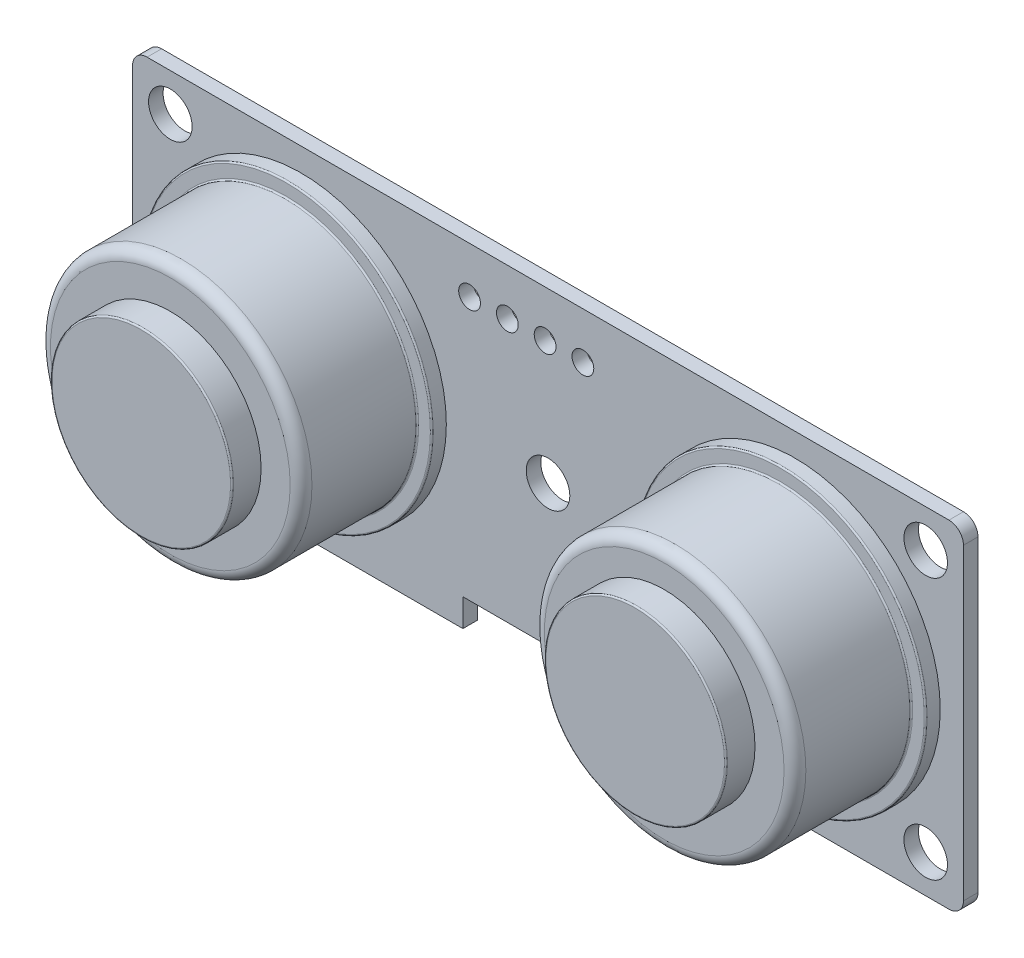
from build123d import *

# Parameters (mm, degrees)
IZIM1_R                       = 1.5
IZIM1_R_2                     = 0.9
IZIM1_R_3                     = 0.75
Y_KSEKLIK_EKSTR_ZYON1_DEPTH   = 1
IZIM2_R                       = 10
Y_KSEKLIK_EKSTR_ZYON2_DEPTH   = 1
Y_KSEKLIK_EKSTR_ZYON2_2_DEPTH = 1
IZIM3_R                       = 9
Y_KSEKLIK_EKSTR_ZYON3_DEPTH   = 8
IZIM4_R                       = 6.25
Y_KSEKLIK_EKSTR_ZYON4_DEPTH   = 2
Y_KSEKLIK_EKSTR_ZYON4_2_DEPTH = 2
RADYUS1_R                     = 0.75
RADYUS2_R                     = 0.75
RADYUS3_R                     = 0.1
RADYUS4_R                     = 0.1
RADYUS5_R                     = 0.1
RADYUS6_R                     = 0.1
IZIM10_W                      = 8.819688083
IZIM10_H                      = 3.272322434
Y_KSEKLIK_EKSTR_ZYON7_DEPTH   = 1
IZIM10_W_2                    = 4.252142999
IZIM10_H_2                    = 6.514979332
Y_KSEKLIK_EKSTR_ZYON7_2_DEPTH = 1
IZIM10_W_3                    = 2.859811135
IZIM10_H_3                    = 1.249099526
Y_KSEKLIK_EKSTR_ZYON7_3_DEPTH = 1
IZIM10_W_4                    = 1.523286018
IZIM10_H_4                    = 2.098180251
Y_KSEKLIK_EKSTR_ZYON7_4_DEPTH = 1
IZIM10_H_5                    = 2.098180252
Y_KSEKLIK_EKSTR_ZYON7_5_DEPTH = 1
Y_KSEKLIK_EKSTR_ZYON7_6_DEPTH = 1
Y_KSEKLIK_EKSTR_ZYON7_7_DEPTH = 1
IZIM10_W_5                    = 1.523286017
Y_KSEKLIK_EKSTR_ZYON7_8_DEPTH = 1
IZIM11_W                      = 1.523286018
IZIM11_H                      = 0.5
IZIM11_W_2                    = 0.540144464
IZIM11_H_2                    = 1.403005975
IZIM11_W_3                    = 0.760592417
IZIM11_H_3                    = 0.891496451
IZIM11_W_4                    = 0.760592416
IZIM11_W_5                    = 0.972454052
IZIM11_H_4                    = 0.818377283
IZIM11_W_6                    = 1.587428627
IZIM11_H_5                    = 0.471493938
IZIM11_W_7                    = 1.587428626
IZIM11_H_6                    = 0.891496452
IZIM11_W_8                    = 0.972454053
IZIM11_W_9                    = 1.523286017
Y_KSEKLIK_EKSTR_ZYON8_DEPTH   = 1
RADYUS8_R                     = 0.5


with BuildPart() as part:
    # Çizim1 → Yükseklik-Ekstrüzyon1 (new body)
    with BuildSketch(Plane.XY):
        with BuildLine():
            Line((-5.859507909, -11.6), (-27.6, -11.6))
            ThreePointArc((-27.6, -11.6), (-28.307106781, -11.307106781), (-28.6, -10.6))
            Line((-28.6, -10.6), (-28.6, 10.6))
            ThreePointArc((-28.6, 10.6), (-28.307106781, 11.307106781), (-27.6, 11.6))
            Line((-27.6, 11.6), (27.6, 11.6))
            ThreePointArc((27.6, 11.6), (28.307106781, 11.307106781), (28.6, 10.6))
            Line((28.6, 10.6), (28.6, -10.6))
            ThreePointArc((28.6, -10.6), (28.307106781, -11.307106781), (27.6, -11.6))
            Line((27.6, -11.6), (5.859507909, -11.6))
            Line((5.859507909, -11.6), (5.859507909, -9.697869581))
            Line((5.859507909, -9.697869581), (-5.859507909, -9.697869581))
            Line((-5.859507909, -9.697869581), (-5.859507909, -11.6))
        make_face()
        with Locations((-26, 9)):
            Circle(IZIM1_R, mode=Mode.SUBTRACT)
        with Locations(Location((26, 9, 0), (0, 0, 180))):
            Circle(IZIM1_R, mode=Mode.SUBTRACT)
        with Locations((26, -9)):
            Circle(IZIM1_R, mode=Mode.SUBTRACT)
        with Locations(Location((-26, -9, 0), (0, 0, 180))):
            Circle(IZIM1_R, mode=Mode.SUBTRACT)
        Circle(IZIM1_R, mode=Mode.SUBTRACT)
        with Locations((-17.1, 5.1)):
            Circle(IZIM1_R_2, mode=Mode.SUBTRACT)
        with Locations((-17.1, -5.1)):
            Circle(IZIM1_R_2, mode=Mode.SUBTRACT)
        with Locations(Location((17.1, -5.1, 0), (0, 0, 180))):
            Circle(IZIM1_R_2, mode=Mode.SUBTRACT)
        with Locations(Location((17.1, 5.1, 0), (0, 0, 180))):
            Circle(IZIM1_R_2, mode=Mode.SUBTRACT)
        with Locations((-5.4, 8.4)):
            Circle(IZIM1_R_3, mode=Mode.SUBTRACT)
        with Locations((-2.8, 8.4)):
            Circle(IZIM1_R_3, mode=Mode.SUBTRACT)
        with Locations((-0.2, 8.4)):
            Circle(IZIM1_R_3, mode=Mode.SUBTRACT)
        with Locations((2.4, 8.4)):
            Circle(IZIM1_R_3, mode=Mode.SUBTRACT)
    extrude(amount=Y_KSEKLIK_EKSTR_ZYON1_DEPTH)

    # Çizim11 → Yükseklik-Ekstrüzyon8 (add)
    with BuildSketch(Plane(origin=(0, 0, 0), x_dir=(-1, 0, 0), z_dir=(0, 0, -1))):
        with Locations((12.042521961, 9.897389484)):
            Rectangle(IZIM11_W, IZIM11_H)
        with Locations((12.042521961, 7.145647)):
            Rectangle(IZIM11_W, IZIM11_H)
        with Locations((-13.496244002, 5.165864897)):
            Rectangle(IZIM11_W_2, IZIM11_H_2)
        with Locations((-12.146244002, 5.165864897)):
            Rectangle(IZIM11_W_2, IZIM11_H_2)
        with Locations((-10.796244002, 5.165864897)):
            Rectangle(IZIM11_W_2, IZIM11_H_2)
        with Locations((-9.446244002, 5.165864897)):
            Rectangle(IZIM11_W_2, IZIM11_H_2)
        with Locations((-8.096244002, 5.165864897)):
            Rectangle(IZIM11_W_2, IZIM11_H_2)
        with Locations((-6.746244002, 5.165864897)):
            Rectangle(IZIM11_W_2, IZIM11_H_2)
        with Locations((-5.396244002, 5.165864897)):
            Rectangle(IZIM11_W_2, IZIM11_H_2)
        with Locations((-5.396244002, 0.38887726)):
            Rectangle(IZIM11_W_2, IZIM11_H_2)
        with Locations((-6.746244002, 0.38887726)):
            Rectangle(IZIM11_W_2, IZIM11_H_2)
        with Locations((-8.096244002, 0.38887726)):
            Rectangle(IZIM11_W_2, IZIM11_H_2)
        with Locations((-9.446244002, 0.38887726)):
            Rectangle(IZIM11_W_2, IZIM11_H_2)
        with Locations((-10.796244002, 0.38887726)):
            Rectangle(IZIM11_W_2, IZIM11_H_2)
        with Locations((-12.146244002, 0.38887726)):
            Rectangle(IZIM11_W_2, IZIM11_H_2)
        with Locations((-13.496244002, 0.38887726)):
            Rectangle(IZIM11_W_2, IZIM11_H_2)
        with Locations((-22.478191103, 5.059280521)):
            Rectangle(IZIM11_W_3, IZIM11_H_3)
        with Locations((-20.378972384, 5.059280521)):
            Rectangle(IZIM11_W_4, IZIM11_H_3)
        with Locations((-21.428581743, 7.263316914)):
            Rectangle(IZIM11_W_5, IZIM11_H_4)
        with Locations((4.065057136, -3.225479304)):
            Rectangle(IZIM11_W_6, IZIM11_H_5)
        with Locations((4.065057136, -2.555479304)):
            Rectangle(IZIM11_W_6, IZIM11_H_5)
        with Locations((4.065057136, -3.895479304)):
            Rectangle(IZIM11_W_6, IZIM11_H_5)
        with Locations((4.065057136, -4.565479304)):
            Rectangle(IZIM11_W_6, IZIM11_H_5)
        with Locations((4.065057136, -5.235479304)):
            Rectangle(IZIM11_W_6, IZIM11_H_5)
        with Locations((4.065057136, -5.905479304)):
            Rectangle(IZIM11_W_6, IZIM11_H_5)
        with Locations((4.065057136, -6.575479304)):
            Rectangle(IZIM11_W_6, IZIM11_H_5)
        with Locations((4.065057136, -7.245479304)):
            Rectangle(IZIM11_W_6, IZIM11_H_5)
        with Locations((4.065057136, -7.915479304)):
            Rectangle(IZIM11_W_6, IZIM11_H_5)
        with Locations((4.065057136, -8.585479304)):
            Rectangle(IZIM11_W_6, IZIM11_H_5)
        with Locations((10.038946882, -8.585479304)):
            Rectangle(IZIM11_W_7, IZIM11_H_5)
        with Locations((10.038946882, -7.915479304)):
            Rectangle(IZIM11_W_7, IZIM11_H_5)
        with Locations((10.038946882, -7.245479304)):
            Rectangle(IZIM11_W_7, IZIM11_H_5)
        with Locations((10.038946882, -6.575479304)):
            Rectangle(IZIM11_W_7, IZIM11_H_5)
        with Locations((10.038946882, -5.905479304)):
            Rectangle(IZIM11_W_7, IZIM11_H_5)
        with Locations((10.038946882, -5.235479304)):
            Rectangle(IZIM11_W_7, IZIM11_H_5)
        with Locations((10.038946882, -4.565479304)):
            Rectangle(IZIM11_W_7, IZIM11_H_5)
        with Locations((10.038946882, -3.895479304)):
            Rectangle(IZIM11_W_7, IZIM11_H_5)
        with Locations((10.038946882, -3.225479304)):
            Rectangle(IZIM11_W_7, IZIM11_H_5)
        with Locations((10.038946882, -2.555479304)):
            Rectangle(IZIM11_W_7, IZIM11_H_5)
        with Locations((22.432174204, 8.872255908)):
            Rectangle(IZIM11_W, IZIM11_H)
        with Locations((22.432174204, 6.120513424)):
            Rectangle(IZIM11_W, IZIM11_H)
        with Locations((15.124101084, 3.408555632)):
            Rectangle(IZIM11_W_3, IZIM11_H_6)
        with Locations((13.024882365, 3.408555632)):
            Rectangle(IZIM11_W_4, IZIM11_H_6)
        with Locations((14.074491724, 1.204519239)):
            Rectangle(IZIM11_W_5, IZIM11_H_4)
        with Locations((-2.561484485, -6.352037632)):
            Rectangle(IZIM11_W_8, IZIM11_H_4)
        with Locations((-1.511875125, -8.556074025)):
            Rectangle(IZIM11_W_4, IZIM11_H_6)
        with Locations((-3.611093844, -8.556074025)):
            Rectangle(IZIM11_W_4, IZIM11_H_6)
        with Locations((9.412637748, 6.264156986)):
            Rectangle(IZIM11_W_9, IZIM11_H)
        with Locations((9.412637748, 3.512414502)):
            Rectangle(IZIM11_W_9, IZIM11_H)
    extrude(amount=Y_KSEKLIK_EKSTR_ZYON8_DEPTH)

    # Radyus8
    radyus8_edges = [part.edges().sort_by_distance(p)[0] for p in [
        (3.611093844, -9.001822251, -1),
        (1.511875125, -9.001822251, -1),
        (2.561484484, -5.94284899, -1),
        (-3.271342822, -2.555479304, -1),
        (-3.271342822, -3.225479304, -1),
        (-3.271342822, -3.895479304, -1),
        (-3.271342822, -4.565479304, -1),
        (-3.271342822, -5.235479304, -1),
        (-3.271342822, -5.905479304, -1),
        (-3.271342822, -6.575479304, -1),
        (-3.271342822, -7.245479304, -1),
        (-3.271342822, -7.915479304, -1),
        (-3.271342822, -8.585479304, -1),
        (-10.832661195, -8.585479304, -1),
        (-10.832661195, -7.915479304, -1),
        (-10.832661195, -7.245479304, -1),
        (-10.832661195, -6.575479304, -1),
        (-10.832661195, -5.905479304, -1),
        (-10.832661195, -5.235479304, -1),
        (-10.832661195, -4.565479304, -1),
        (-10.832661195, -3.895479304, -1),
        (-10.832661195, -3.225479304, -1),
        (-10.832661195, -2.555479304, -1),
        (-14.074491724, 0.795330597, -1),
        (-15.124101083, 3.854303858, -1),
        (-13.024882365, 3.854303858, -1),
        (-22.432174204, 5.870513424, -1),
        (-22.432174204, 9.122255908, -1),
        (-12.042521961, 6.895647, -1),
        (-12.042521961, 10.147389484, -1),
        (5.396244002, -0.312625728, -1),
        (6.746244002, -0.312625728, -1),
        (8.096244002, -0.312625728, -1),
        (9.446244002, -0.312625728, -1),
        (10.796244002, -0.312625728, -1),
        (12.146244002, -0.312625728, -1),
        (13.496244002, -0.312625728, -1),
        (5.396244002, 5.867367884, -1),
        (6.746244002, 5.867367884, -1),
        (8.096244002, 5.867367884, -1),
        (9.446244002, 5.867367884, -1),
        (10.796244002, 5.867367884, -1),
        (12.146244002, 5.867367884, -1),
        (13.496244002, 5.867367884, -1),
        (20.378972384, 4.613532295, -1),
        (22.478191103, 4.613532295, -1),
        (21.428581743, 7.672505555, -1),
        (-9.412637748, 3.262414502, -1),
        (-9.412637748, 6.514156986, -1),
    ]]
    fillet(radyus8_edges, radius=RADYUS8_R - 0.0001)  # a hair under: the kernel refuses the full size


with BuildPart() as body_2:
    # Çizim2 → Yükseklik-Ekstrüzyon2 (new body)
    with BuildSketch(Plane.XY.offset(1)):
        with Locations((-17, 0)):
            Circle(IZIM2_R)
    extrude(amount=Y_KSEKLIK_EKSTR_ZYON2_DEPTH)



with BuildPart() as body_3:
    # Çizim2 → Y_kseklik-Ekstr_zyon2 2 (new body)
    with BuildSketch(Plane.XY.offset(1)):
        with Locations((17, 0)):
            Circle(IZIM2_R)
    extrude(amount=Y_KSEKLIK_EKSTR_ZYON2_2_DEPTH)


with BuildPart() as body_2_1:
    add(body_2.part)

    add(body_3.part)  # Yükseklik-Ekstrüzyon3 merges body 3
    # Çizim3 → Yükseklik-Ekstrüzyon3 (add)
    with BuildSketch(Plane.XY.offset(2)):
        with Locations((-17, 0)):
            Circle(IZIM3_R)
        with Locations((17, 0)):
            Circle(IZIM3_R)
    extrude(amount=Y_KSEKLIK_EKSTR_ZYON3_DEPTH)

    # Radyus1
    radyus1_edges = [body_2_1.edges().sort_by_distance(p)[0] for p in [
        (-26, 0, 10),
    ]]
    fillet(radyus1_edges, radius=RADYUS1_R)

    # Radyus2
    radyus2_edges = [body_2_1.edges().sort_by_distance(p)[0] for p in [
        (8, 0, 10),
    ]]
    fillet(radyus2_edges, radius=RADYUS2_R)

    # Radyus5
    radyus5_edges = [body_2_1.edges().sort_by_distance(p)[0] for p in [
        (-27, 0, 2),
        (-26, 0, 2),
    ]]
    fillet(radyus5_edges, radius=RADYUS5_R)

    # Radyus6
    radyus6_edges = [body_2_1.edges().sort_by_distance(p)[0] for p in [
        (7, 0, 2),
        (8, 0, 2),
    ]]
    fillet(radyus6_edges, radius=RADYUS6_R)


with BuildPart() as body_3_2:
    # Çizim4 → Yükseklik-Ekstrüzyon4 (new body)
    with BuildSketch(Plane.XY.offset(10)):
        with Locations((-17, 0)):
            Circle(IZIM4_R)
    extrude(amount=Y_KSEKLIK_EKSTR_ZYON4_DEPTH)

    # Radyus3
    radyus3_edges = [body_3_2.edges().sort_by_distance(p)[0] for p in [
        (-23.25, 0, 12),
    ]]
    fillet(radyus3_edges, radius=RADYUS3_R)


with BuildPart() as body_4:
    # Çizim4 → Y_kseklik-Ekstr_zyon4 2 (new body)
    with BuildSketch(Plane.XY.offset(10)):
        with Locations((17, 0.413900631)):
            Circle(IZIM4_R)
    extrude(amount=Y_KSEKLIK_EKSTR_ZYON4_2_DEPTH)

    # Radyus4
    radyus4_edges = [body_4.edges().sort_by_distance(p)[0] for p in [
        (10.75, 0.413900631, 12),
    ]]
    fillet(radyus4_edges, radius=RADYUS4_R)


with BuildPart() as body_5:
    # Çizim10 → Yükseklik-Ekstrüzyon7 (new body)
    with BuildSketch(Plane(origin=(0, 0, 0), x_dir=(-1, 0, 0), z_dir=(0, 0, -1))):
        with Locations((-9.501875317, 2.772391464)):
            Rectangle(IZIM10_W, IZIM10_H)
    extrude(amount=Y_KSEKLIK_EKSTR_ZYON7_DEPTH)


with BuildPart() as body_6:
    # Çizim10 → Y_kseklik-Ekstr_zyon7 2 (new body)
    with BuildSketch(Plane(origin=(0, 0, 0), x_dir=(-1, 0, 0), z_dir=(0, 0, -1))):
        with Locations((7.052002009, -5.582201615)):
            Rectangle(IZIM10_W_2, IZIM10_H_2)
    extrude(amount=Y_KSEKLIK_EKSTR_ZYON7_2_DEPTH)


with BuildPart() as body_7:
    # Çizim10 → Y_kseklik-Ekstr_zyon7 3 (new body)
    with BuildSketch(Plane(origin=(0, 0, 0), x_dir=(-1, 0, 0), z_dir=(0, 0, -1))):
        with Locations((-21.428581744, 6.174598896)):
            Rectangle(IZIM10_W_3, IZIM10_H_3)
    extrude(amount=Y_KSEKLIK_EKSTR_ZYON7_3_DEPTH)


with BuildPart() as body_8:
    # Çizim10 → Y_kseklik-Ekstr_zyon7 4 (new body)
    with BuildSketch(Plane(origin=(0, 0, 0), x_dir=(-1, 0, 0), z_dir=(0, 0, -1))):
        with Locations((12.042521961, 8.525148124)):
            Rectangle(IZIM10_W_4, IZIM10_H_4)
    extrude(amount=Y_KSEKLIK_EKSTR_ZYON7_4_DEPTH)


with BuildPart() as body_9:
    # Çizim10 → Y_kseklik-Ekstr_zyon7 5 (new body)
    with BuildSketch(Plane(origin=(0, 0, 0), x_dir=(-1, 0, 0), z_dir=(0, 0, -1))):
        with Locations((22.432174204, 7.500014548)):
            Rectangle(IZIM10_W_4, IZIM10_H_5)
    extrude(amount=Y_KSEKLIK_EKSTR_ZYON7_5_DEPTH)


with BuildPart() as body_10:
    # Çizim10 → Y_kseklik-Ekstr_zyon7 6 (new body)
    with BuildSketch(Plane(origin=(0, 0, 0), x_dir=(-1, 0, 0), z_dir=(0, 0, -1))):
        with Locations((14.074491724, 2.283278029)):
            Rectangle(IZIM10_W_3, IZIM10_H_3)
    extrude(amount=Y_KSEKLIK_EKSTR_ZYON7_6_DEPTH)


with BuildPart() as body_11:
    # Çizim10 → Y_kseklik-Ekstr_zyon7 7 (new body)
    with BuildSketch(Plane(origin=(0, 0, 0), x_dir=(-1, 0, 0), z_dir=(0, 0, -1))):
        with Locations((-2.561484485, -7.44075565)):
            Rectangle(IZIM10_W_3, IZIM10_H_3)
    extrude(amount=Y_KSEKLIK_EKSTR_ZYON7_7_DEPTH)


with BuildPart() as body_12:
    # Çizim10 → Y_kseklik-Ekstr_zyon7 8 (new body)
    with BuildSketch(Plane(origin=(0, 0, 0), x_dir=(-1, 0, 0), z_dir=(0, 0, -1))):
        with Locations((9.412637748, 4.878315577)):
            Rectangle(IZIM10_W_5, IZIM10_H_4)
    extrude(amount=Y_KSEKLIK_EKSTR_ZYON7_8_DEPTH)


solid = Compound([part.part, body_2_1.part, body_3_2.part, body_4.part, body_5.part, body_6.part, body_7.part, body_8.part, body_9.part, body_10.part, body_11.part, body_12.part])
